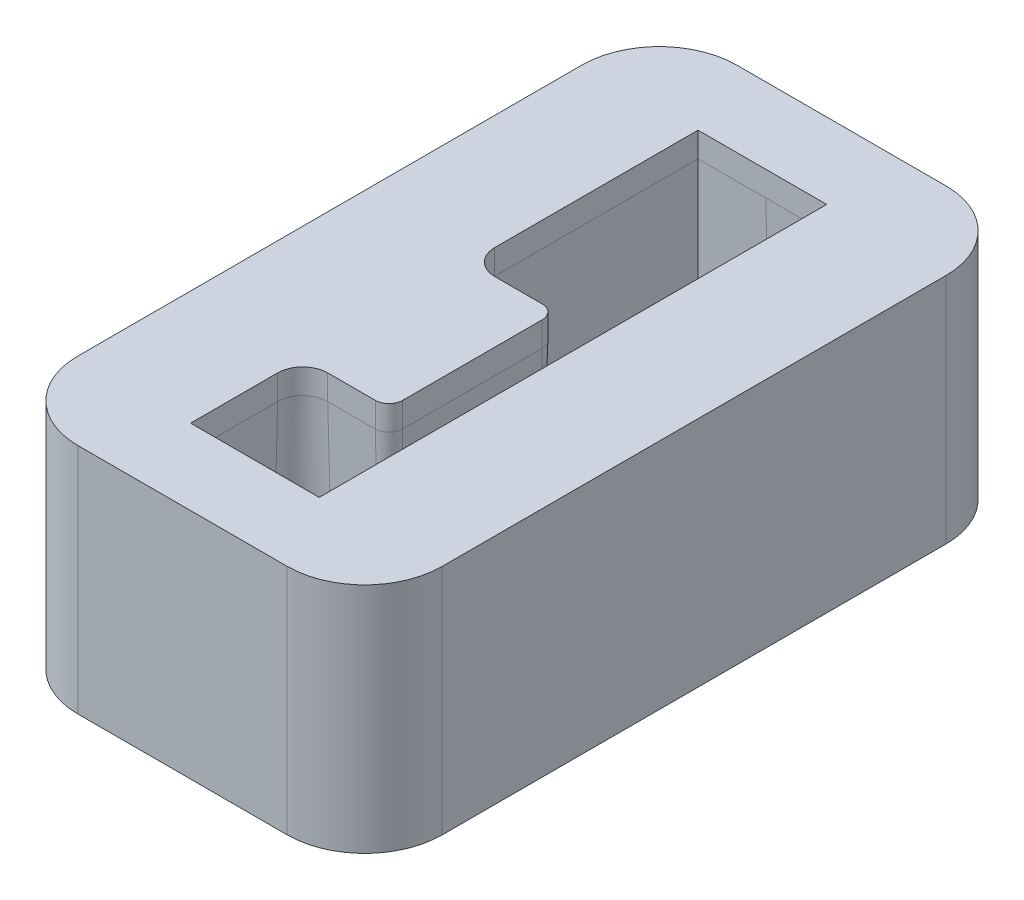
from build123d import *

# Parameters (mm, degrees)
SKETCH1_W                   = 47
SKETCH1_H                   = 85
BOSS_EXTRUDE1_DEPTH         = 30
FILLET1_R                   = 10
CUT_EXTRUDE1_REACH          = 59.083
M6_TAPPED_HOLE1_D           = 5
M6_TAPPED_HOLE1_DEPTH       = 17
M6_TAPPED_HOLE1_CSINK_D     = 6.05
M6_TAPPED_HOLE1_CSINK_ANGLE = 90
M6_TAPPED_HOLE1_TIP         = 1.502151548


with BuildPart() as part:
    # Sketch1 → Boss-Extrude1 (new body)
    with BuildSketch(Plane(origin=(0, 0, 0), x_dir=(1, 0, 0), z_dir=(0, 1, 0))):
        Rectangle(SKETCH1_W, SKETCH1_H)
    extrude(amount=-BOSS_EXTRUDE1_DEPTH)

    # Fillet1
    fillet1_edges = [part.edges().sort_by_distance(p)[0] for p in [
        (-23.5, -15, -42.5),
        (23.5, -15, -42.5),
        (-23.5, -15, 42.5),
        (23.5, -15, 42.5),
    ]]
    fillet(fillet1_edges, radius=FILLET1_R)

    # Sketch3 → Cut-Extrude1 (cut, up to next)
    with BuildSketch(Plane(origin=(0, 0, 0), x_dir=(1, 0, 0), z_dir=(0, 1, 0)), mode=Mode.PRIVATE) as cut_extrude1_sk1:
        with BuildLine():
            Line((7.86, 32.73), (-8.73, 32.73))
            Line((-8.73, 32.73), (-8.73, 6.5))
            ThreePointArc((-8.73, 6.5), (-7.783954903, 4.216045097), (-5.5, 3.27))
            Line((-5.5, 3.27), (0.63, 3.27))
            ThreePointArc((0.63, 3.27), (1.881579003, 2.751579003), (2.4, 1.5))
            Line((2.4, 1.5), (2.4, -16.5))
            ThreePointArc((2.4, -16.5), (1.881579003, -17.751579003), (0.63, -18.27))
            Line((0.63, -18.27), (-5.5, -18.27))
            ThreePointArc((-5.5, -18.27), (-7.783954903, -19.216045097), (-8.73, -21.5))
            Line((-8.73, -21.5), (-8.73, -32.73))
            Line((-8.73, -32.73), (7.86, -32.73))
            Line((7.86, -32.73), (7.86, 32.73))
        make_face()
    cut_extrude1_tool1 = extrude(cut_extrude1_sk1.sketch, amount=-CUT_EXTRUDE1_REACH, mode=Mode.PRIVATE) & part.part
    add(cut_extrude1_tool1.solids().sort_by_distance((-8.054705, 0, 27.115))[0], mode=Mode.SUBTRACT)

    # Cut-Sweep1: sweep along a path in Sketch5
    with BuildLine(Plane(origin=(0, 0, 0), x_dir=(1, 0, 0), z_dir=(0, 1, 0))) as cut_sweep1_path:
        Line((-8.73, -32.73), (7.86, -32.73))
        Line((7.86, -32.73), (7.86, 32.73))
        Line((7.86, 32.73), (-8.73, 32.73))
        Line((-8.73, 32.73), (-8.73, 6.5))
        ThreePointArc((-8.73, 6.5), (-7.783954903, 4.216045097), (-5.5, 3.27))
        Line((-5.5, 3.27), (0.63, 3.27))
        ThreePointArc((0.63, 3.27), (1.881579003, 2.751579003), (2.4, 1.5))
        Line((2.4, 1.5), (2.4, -16.5))
        ThreePointArc((2.4, -16.5), (1.881579003, -17.751579003), (0.63, -18.27))
        Line((0.63, -18.27), (-5.5, -18.27))
        ThreePointArc((-5.5, -18.27), (-7.783954903, -19.216045097), (-8.73, -21.5))
        Line((-8.73, -21.5), (-8.73, -32.73))
    # Sketch4 → Cut-Sweep1 (sweep, cut)
    with BuildSketch(Plane(origin=(0, 0, 0), x_dir=(0, 0, -1), z_dir=(1, 0, 0))):
        Polygon((32.73, -3.2), (33.431782698, -30), (32.73, -30), align=None)
    sweep(path=cut_sweep1_path.line, transition=Transition.RIGHT, mode=Mode.SUBTRACT)

    # M6 Tapped Hole1
    with Locations(Plane(origin=(0, -30, 0), x_dir=(-1, 0, 0), z_dir=(0, -1, 0))):
        with Locations((-16.5, 35.5), (16.5, 35.5), (16.5, -35.5), (-16.5, -35.5)):
            CounterSinkHole(M6_TAPPED_HOLE1_D / 2, M6_TAPPED_HOLE1_CSINK_D / 2, depth=M6_TAPPED_HOLE1_DEPTH, counter_sink_angle=M6_TAPPED_HOLE1_CSINK_ANGLE)
            with Locations((0, 0, -(M6_TAPPED_HOLE1_DEPTH + M6_TAPPED_HOLE1_TIP / 2))):  # 118° drill point
                Cone(0, M6_TAPPED_HOLE1_D / 2, M6_TAPPED_HOLE1_TIP, mode=Mode.SUBTRACT)


solid = part.part
